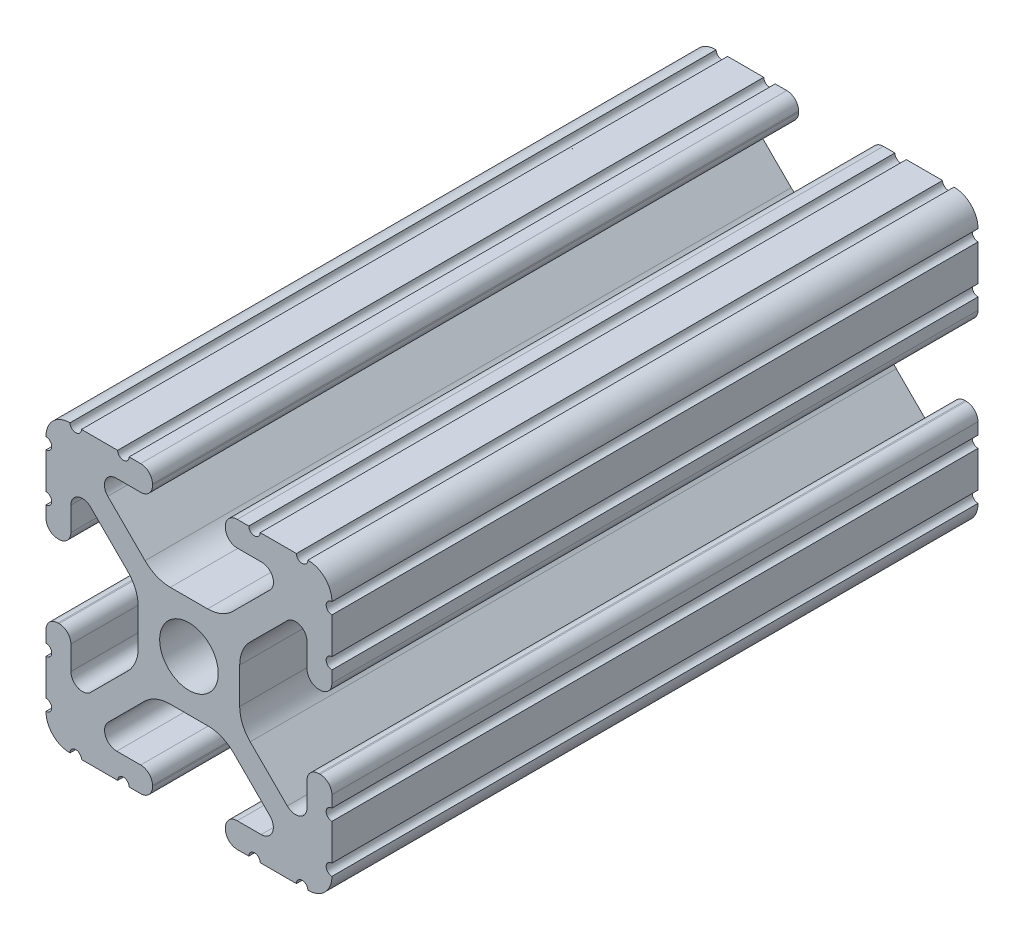
from build123d import *

# Parameters (mm, degrees)
SKETCH1_R           = 2.6035
BOSS_EXTRUDE1_DEPTH = 152.4
SKETCH2_R           = 23.941884012
CUT_EXTRUDE1_DEPTH  = 247.396


with BuildPart() as part:
    # Sketch1 → Boss-Extrude1 (new, symmetric)
    with BuildSketch(Plane.XY):
        with BuildLine():
            Line((-7.179650497, -8.645192506), (-3.952270251, -5.423690499))
            ThreePointArc((-3.952270251, -5.423690499), (-2.922936451, -4.736929036), (-1.709253557, -4.4958))
            Line((-1.709253557, -4.4958), (1.709253557, -4.4958))
            ThreePointArc((1.709253557, -4.4958), (2.922936451, -4.736929036), (3.952270251, -5.423690499))
            Line((3.952270251, -5.423690499), (7.179650497, -8.645192506))
            ThreePointArc((7.179650497, -8.645192506), (7.41473083, -9.822813117), (6.416408329, -10.4902))
            Line((6.416408329, -10.4902), (4.287512407, -10.4902))
            ThreePointArc((4.287512407, -10.4902), (3.54574862, -10.79744862), (3.2385, -11.539212407))
            Line((3.2385, -11.539212407), (3.2385, -11.650987593))
            ThreePointArc((3.2385, -11.650987593), (3.54574862, -12.39275138), (4.287512407, -12.7))
            Line((4.287512407, -12.7), (5.317126718, -12.7))
            ThreePointArc((5.317126718, -12.7), (5.825126718, -12.192), (6.333126718, -12.7))
            Line((6.333126718, -12.7), (9.550443118, -12.7))
            ThreePointArc((9.550443118, -12.7), (10.058366869, -12.192000006), (10.566443095, -12.699847501))
            ThreePointArc((10.566443095, -12.699847501), (12.082537762, -12.08250727), (12.699846982, -10.566399977))
            ThreePointArc((12.699846982, -10.566399977), (12.192000006, -10.058323491), (12.7, -9.5504))
            Line((12.7, -9.5504), (12.7, -6.3330836))
            ThreePointArc((12.7, -6.3330836), (12.192, -5.8250836), (12.7, -5.3170836))
            Line((12.7, -5.3170836), (12.7, -4.287469289))
            ThreePointArc((12.7, -4.287469289), (12.39275138, -3.545705502), (11.650987593, -3.238456882))
            Line((11.650987593, -3.238456882), (11.539212407, -3.238456882))
            ThreePointArc((11.539212407, -3.238456882), (10.79744862, -3.545705502), (10.4902, -4.287469289))
            Line((10.4902, -4.287469289), (10.4902, -6.402089023))
            ThreePointArc((10.4902, -6.402089023), (9.856505071, -7.351067942), (8.737131347, -7.129408934))
            Line((8.737131347, -7.129408934), (5.441005833, -3.840816462))
            ThreePointArc((5.441005833, -3.840816462), (4.750877967, -2.809883091), (4.5085, -1.593185507))
            Line((4.5085, -1.593185507), (4.5085, 1.593185507))
            ThreePointArc((4.5085, 1.593185507), (4.750877967, 2.809883091), (5.441005833, 3.840816462))
            Line((5.441005833, 3.840816462), (8.737131347, 7.129408934))
            ThreePointArc((8.737131347, 7.129408934), (9.856505071, 7.351067942), (10.4902, 6.402089023))
            Line((10.4902, 6.402089023), (10.4902, 4.287469289))
            ThreePointArc((10.4902, 4.287469289), (10.79744862, 3.545705502), (11.539212407, 3.238456882))
            Line((11.539212407, 3.238456882), (11.650987593, 3.238456882))
            ThreePointArc((11.650987593, 3.238456882), (12.39275138, 3.545705502), (12.7, 4.287469289))
            Line((12.7, 4.287469289), (12.7, 5.3170836))
            ThreePointArc((12.7, 5.3170836), (12.192, 5.8250836), (12.7, 6.3330836))
            Line((12.7, 6.3330836), (12.7, 9.5504))
            ThreePointArc((12.7, 9.5504), (12.192000006, 10.058323491), (12.699846982, 10.566399977))
            ThreePointArc((12.699846982, 10.566399977), (12.082537762, 12.08250727), (10.566443095, 12.699847501))
            ThreePointArc((10.566443095, 12.699847501), (10.058366869, 12.192000006), (9.550443118, 12.7))
            Line((9.550443118, 12.7), (6.333126718, 12.7))
            ThreePointArc((6.333126718, 12.7), (5.825126718, 12.192), (5.317126718, 12.7))
            Line((5.317126718, 12.7), (4.287512407, 12.7))
            ThreePointArc((4.287512407, 12.7), (3.54574862, 12.39275138), (3.2385, 11.650987593))
            Line((3.2385, 11.650987593), (3.2385, 11.539212407))
            ThreePointArc((3.2385, 11.539212407), (3.54574862, 10.79744862), (4.287512407, 10.4902))
            Line((4.287512407, 10.4902), (6.476788598, 10.4902))
            ThreePointArc((6.476788598, 10.4902), (7.432222385, 9.85140422), (7.207036008, 8.724370562))
            Line((7.207036008, 8.724370562), (3.898272566, 5.423169045))
            ThreePointArc((3.898272566, 5.423169045), (2.869120213, 4.736787962), (1.655778399, 4.4958))
            Line((1.655778399, 4.4958), (-1.655778399, 4.4958))
            ThreePointArc((-1.655778399, 4.4958), (-2.869120213, 4.736787962), (-3.898272566, 5.423169045))
            Line((-3.898272566, 5.423169045), (-7.207036008, 8.724370562))
            ThreePointArc((-7.207036008, 8.724370562), (-7.432222385, 9.85140422), (-6.476788598, 10.4902))
            Line((-6.476788598, 10.4902), (-4.287512407, 10.4902))
            ThreePointArc((-4.287512407, 10.4902), (-3.54574862, 10.79744862), (-3.2385, 11.539212407))
            Line((-3.2385, 11.539212407), (-3.2385, 11.650987593))
            ThreePointArc((-3.2385, 11.650987593), (-3.54574862, 12.39275138), (-4.287512407, 12.7))
            Line((-4.287512407, 12.7), (-5.317126718, 12.7))
            ThreePointArc((-5.317126718, 12.7), (-5.825126718, 12.192), (-6.333126718, 12.7))
            Line((-6.333126718, 12.7), (-9.550443118, 12.7))
            ThreePointArc((-9.550443118, 12.7), (-10.058366869, 12.192000006), (-10.566443095, 12.699847501))
            ThreePointArc((-10.566443095, 12.699847501), (-12.082537762, 12.08250727), (-12.699846982, 10.566399977))
            ThreePointArc((-12.699846982, 10.566399977), (-12.192000006, 10.058323491), (-12.7, 9.5504))
            Line((-12.7, 9.5504), (-12.7, 6.3330836))
            ThreePointArc((-12.7, 6.3330836), (-12.192, 5.8250836), (-12.7, 5.3170836))
            Line((-12.7, 5.3170836), (-12.7, 4.287469289))
            ThreePointArc((-12.7, 4.287469289), (-12.39275138, 3.545705502), (-11.650987593, 3.238456882))
            Line((-11.650987593, 3.238456882), (-11.539212407, 3.238456882))
            ThreePointArc((-11.539212407, 3.238456882), (-10.79744862, 3.545705502), (-10.4902, 4.287469289))
            Line((-10.4902, 4.287469289), (-10.4902, 6.402089023))
            ThreePointArc((-10.4902, 6.402089023), (-9.856505071, 7.351067942), (-8.737131347, 7.129408934))
            Line((-8.737131347, 7.129408934), (-5.441005833, 3.840816462))
            ThreePointArc((-5.441005833, 3.840816462), (-4.750877967, 2.809883091), (-4.5085, 1.593185507))
            Line((-4.5085, 1.593185507), (-4.5085, -1.593185507))
            ThreePointArc((-4.5085, -1.593185507), (-4.750877967, -2.809883091), (-5.441005833, -3.840816462))
            Line((-5.441005833, -3.840816462), (-8.737131347, -7.129408934))
            ThreePointArc((-8.737131347, -7.129408934), (-9.856505071, -7.351067942), (-10.4902, -6.402089023))
            Line((-10.4902, -6.402089023), (-10.4902, -4.287469289))
            ThreePointArc((-10.4902, -4.287469289), (-10.79744862, -3.545705502), (-11.539212407, -3.238456882))
            Line((-11.539212407, -3.238456882), (-11.650987593, -3.238456882))
            ThreePointArc((-11.650987593, -3.238456882), (-12.39275138, -3.545705502), (-12.7, -4.287469289))
            Line((-12.7, -4.287469289), (-12.7, -5.3170836))
            ThreePointArc((-12.7, -5.3170836), (-12.192, -5.8250836), (-12.7, -6.3330836))
            Line((-12.7, -6.3330836), (-12.7, -9.5504))
            ThreePointArc((-12.7, -9.5504), (-12.192000006, -10.058323491), (-12.699846982, -10.566399977))
            ThreePointArc((-12.699846982, -10.566399977), (-12.082537762, -12.08250727), (-10.566443095, -12.699847501))
            ThreePointArc((-10.566443095, -12.699847501), (-10.058366869, -12.192000006), (-9.550443118, -12.7))
            Line((-9.550443118, -12.7), (-6.333126718, -12.7))
            ThreePointArc((-6.333126718, -12.7), (-5.825126718, -12.192), (-5.317126718, -12.7))
            Line((-5.317126718, -12.7), (-4.287512407, -12.7))
            ThreePointArc((-4.287512407, -12.7), (-3.54574862, -12.39275138), (-3.2385, -11.650987593))
            Line((-3.2385, -11.650987593), (-3.2385, -11.539212407))
            ThreePointArc((-3.2385, -11.539212407), (-3.54574862, -10.79744862), (-4.287512407, -10.4902))
            Line((-4.287512407, -10.4902), (-6.416408329, -10.4902))
            ThreePointArc((-6.416408329, -10.4902), (-7.41473083, -9.822813117), (-7.179650497, -8.645192506))
        make_face()
        Circle(SKETCH1_R, mode=Mode.SUBTRACT)
    extrude(amount=BOSS_EXTRUDE1_DEPTH, both=True)

    # Sketch2 → Cut-Extrude1 (cut)
    with BuildSketch(Plane.XY.offset(152.4)):
        Circle(SKETCH2_R)
    extrude(amount=-CUT_EXTRUDE1_DEPTH, mode=Mode.SUBTRACT)


solid = part.part
